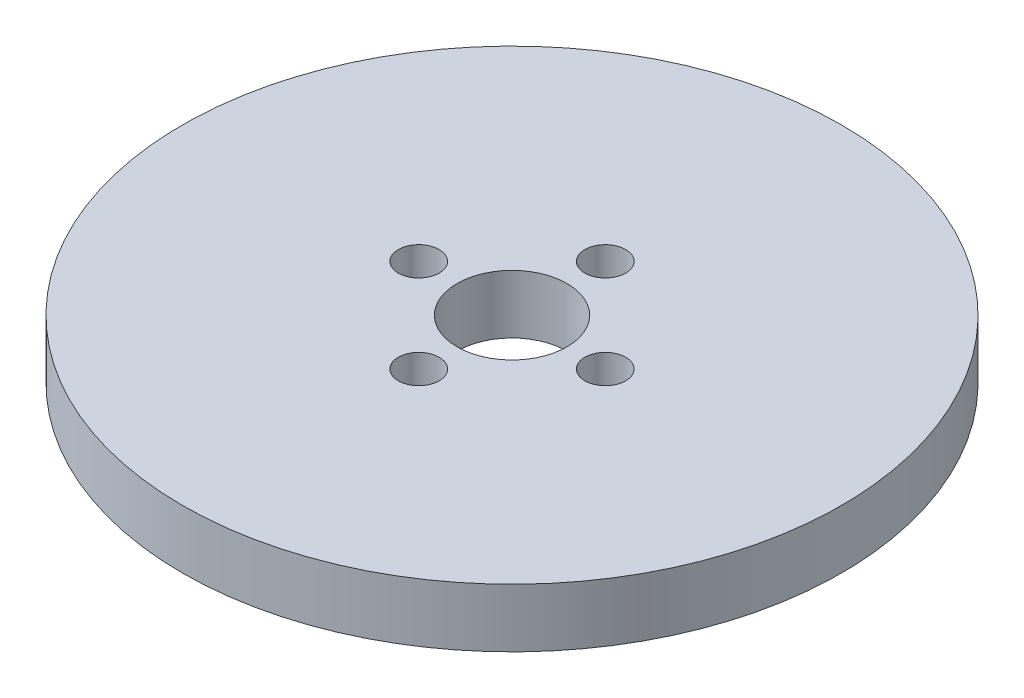
from build123d import *

# Parameters (mm, degrees)
SKETCH1_R           = 45
BOSS_EXTRUDE1_DEPTH = 8
SKETCH2_R           = 7.5
CUT_EXTRUDE1_DEPTH  = 65.140470843
SKETCH3_R           = 2.789752168
CUT_EXTRUDE2_DEPTH  = 5.039477045
CIRPATTERN1_COUNT   = 4


with BuildPart() as part:
    # Sketch1 → Boss-Extrude1 (new body)
    with BuildSketch(Plane(origin=(0, 0, 0), x_dir=(1, 0, 0), z_dir=(0, 1, 0))):
        Circle(SKETCH1_R)
    extrude(amount=BOSS_EXTRUDE1_DEPTH)

    # Sketch2 → Cut-Extrude1 (cut, through all)
    with BuildSketch(Plane(origin=(0, 0, 0), x_dir=(1, 0, 0), z_dir=(0, 1, 0))):
        Circle(SKETCH2_R)
    extrude(amount=CUT_EXTRUDE1_DEPTH, mode=Mode.SUBTRACT)

    # Sketch3 → Cut-Extrude2 (cut)
    with BuildSketch(Plane(origin=(0, 8, 0), x_dir=(1, 0, 0), z_dir=(0, 1, 0))):
        with Locations((-12.736266009, 0)):
            Circle(SKETCH3_R)
    cut_extrude2 = extrude(amount=-CUT_EXTRUDE2_DEPTH, mode=Mode.SUBTRACT)

    # CirPattern1: Cut-Extrude2 ×4 about axis
    cirpattern1_axis = Axis((0, 0, 0), (0, 1, 0))
    for i in range(1, CIRPATTERN1_COUNT):
        add(cut_extrude2.rotate(cirpattern1_axis, i * 360 / CIRPATTERN1_COUNT), mode=Mode.SUBTRACT)


solid = part.part
